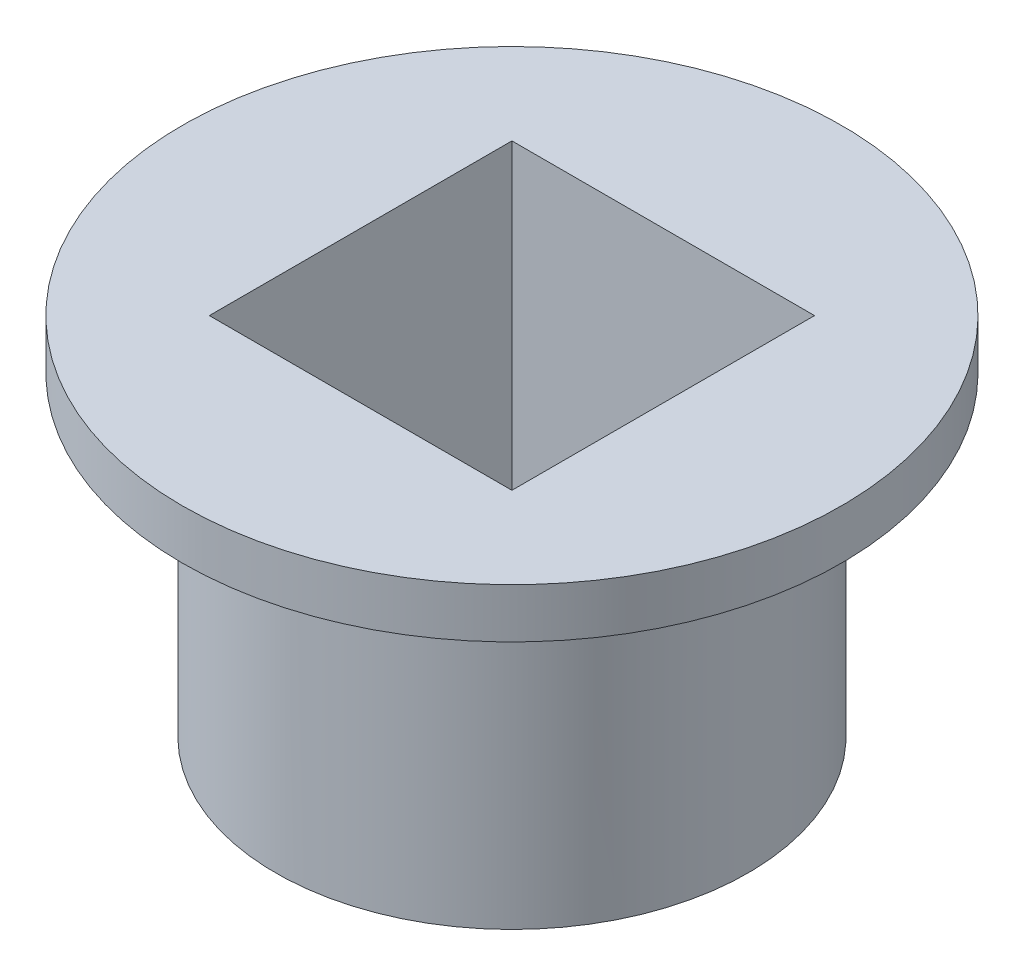
from build123d import *

# Parameters (mm, degrees)
SKETCH1_R           = 9.525
SKETCH1_W           = 12.2
SKETCH1_H           = 12.2
BOSS_EXTRUDE1_DEPTH = 12.70000008
BOSS_EXTRUDE3_START = -2
SKETCH2_R           = 13.2875
SKETCH2_R_2         = 9.525
BOSS_EXTRUDE3_DEPTH = 2
BOSS_EXTRUDE4_START = 2
SKETCH3_R           = 9.525
SKETCH3_R_2         = 4.6
BOSS_EXTRUDE4_DEPTH = 2


with BuildPart() as part:
    # Sketch1 → Boss-Extrude1 (new body)
    with BuildSketch(Plane(origin=(0, 0, 0), x_dir=(1, 0, 0), z_dir=(0, 1, 0))):
        Circle(SKETCH1_R)
        Rectangle(SKETCH1_W, SKETCH1_H, mode=Mode.SUBTRACT)
    extrude(amount=BOSS_EXTRUDE1_DEPTH)

    # Sketch2 → Boss-Extrude3 (add)
    with BuildSketch(Plane(origin=(0, 12.70000008, 0), x_dir=(1, 0, 0), z_dir=(0, 1, 0)).offset(BOSS_EXTRUDE3_START)):
        Circle(SKETCH2_R)
        Circle(SKETCH2_R_2, mode=Mode.SUBTRACT)
    extrude(amount=BOSS_EXTRUDE3_DEPTH)

    # Sketch3 → Boss-Extrude4 (add)
    with BuildSketch(Plane.XZ.offset(BOSS_EXTRUDE4_START)):
        Circle(SKETCH3_R)
        Circle(SKETCH3_R_2, mode=Mode.SUBTRACT)
    extrude(amount=-BOSS_EXTRUDE4_DEPTH)


solid = part.part
